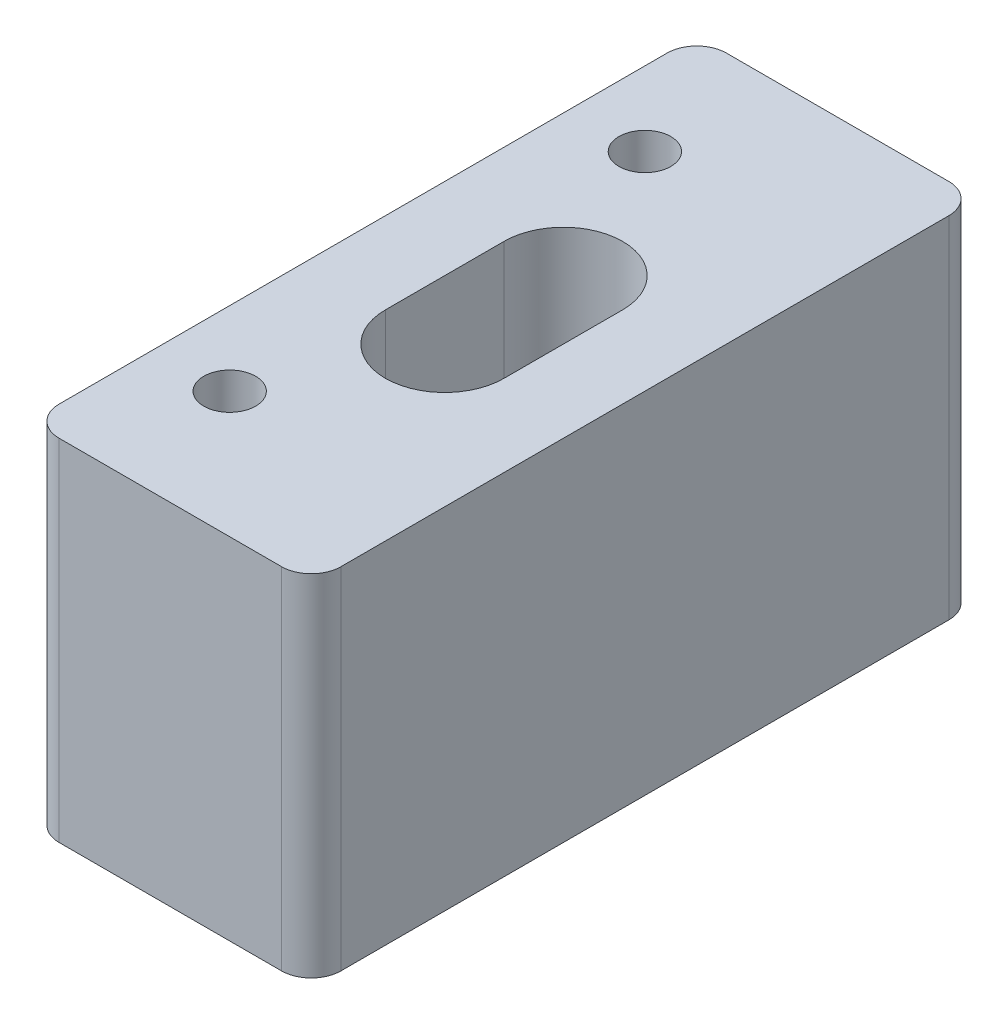
from build123d import *
from build123d.topology import SkipClean

# Parameters (mm, degrees)
SKETCH_1_W          = 19
SKETCH_1_H          = 45
SKETCH_1_R          = 1.75
EXTRUDE_1_DEPTH     = 2
FILLET_1_R          = 2
CUT_EXTRUDE_1_DEPTH = 2
EXTRUDE_START       = 21.612698372
SKETCH_4_R          = 1.75
EXTRUDE_2_DEPTH     = 21.612698372


with BuildPart() as part:
    # 草图1 → 凸台-拉伸1 (new body)
    with BuildSketch(Plane(origin=(0, 0, 0), x_dir=(1, 0, 0), z_dir=(0, 1, 0))):
        with Locations((4.5, 0)):
            Rectangle(SKETCH_1_W, SKETCH_1_H)
        with Locations(Location((0, -14, 0), (0, 0, 270))):
            Circle(SKETCH_1_R, mode=Mode.SUBTRACT)
        with Locations(Location((0, 14, 0), (0, 0, 270))):
            Circle(SKETCH_1_R, mode=Mode.SUBTRACT)
    extrude(amount=EXTRUDE_1_DEPTH)

    # 圆角1
    fillet_1_edges = [part.edges().sort_by_distance(p)[0] for p in [
        (-5, 1, -22.5),
        (14, 1, -22.5),
        (14, 1, 22.5),
        (-5, 1, 22.5),
    ]]
    fillet(fillet_1_edges, radius=FILLET_1_R)

    # 草图3 → 切除-拉伸1 (cut)
    with BuildSketch(Plane(origin=(0, 2, 0), x_dir=(1, 0, 0), z_dir=(0, 1, 0))):
        with BuildLine():
            Line((8.5, 4), (8.5, -4))
            ThreePointArc((8.5, -4), (4.5, -8), (0.5, -4))
            Line((0.5, -4), (0.5, 4))
            ThreePointArc((0.5, 4), (4.5, 8), (8.5, 4))
        make_face()
    extrude(amount=-CUT_EXTRUDE_1_DEPTH, mode=Mode.SUBTRACT)

    # 草图4 → 凸台-拉伸2 (add)
    with SkipClean():  # the faces are left unmerged after this step: merging them gives an invalid solid
        with BuildSketch(Plane(origin=(0, 2, 0), x_dir=(1, 0, 0), z_dir=(0, 1, 0)).offset(EXTRUDE_START)):
            with BuildLine():
                Line((12, 22.5), (-3, 22.5))
                ThreePointArc((-3, 22.5), (-4.414213562, 21.914213562), (-5, 20.5))
                Line((-5, 20.5), (-5, -20.5))
                ThreePointArc((-5, -20.5), (-4.414213562, -21.914213562), (-3, -22.5))
                Line((-3, -22.5), (12, -22.5))
                ThreePointArc((12, -22.5), (13.414213562, -21.914213562), (14, -20.5))
                Line((14, -20.5), (14, 20.5))
                ThreePointArc((14, 20.5), (13.414213562, 21.914213562), (12, 22.5))
            make_face()
            with Locations((0, 14)):
                Circle(SKETCH_4_R, mode=Mode.SUBTRACT)
            with Locations((0, -14)):
                Circle(SKETCH_4_R, mode=Mode.SUBTRACT)
            with BuildLine():
                Line((8.5, -4), (8.5, 4))
                ThreePointArc((8.5, 4), (4.5, 8), (0.5, 4))
                Line((0.5, 4), (0.5, -4))
                ThreePointArc((0.5, -4), (4.5, -8), (8.5, -4))
            make_face(mode=Mode.SUBTRACT)
        extrude(amount=-EXTRUDE_2_DEPTH)
    add(part.part.scale(1), mode=Mode.REPLACE)  # the faces are merged on a copy


solid = part.part
